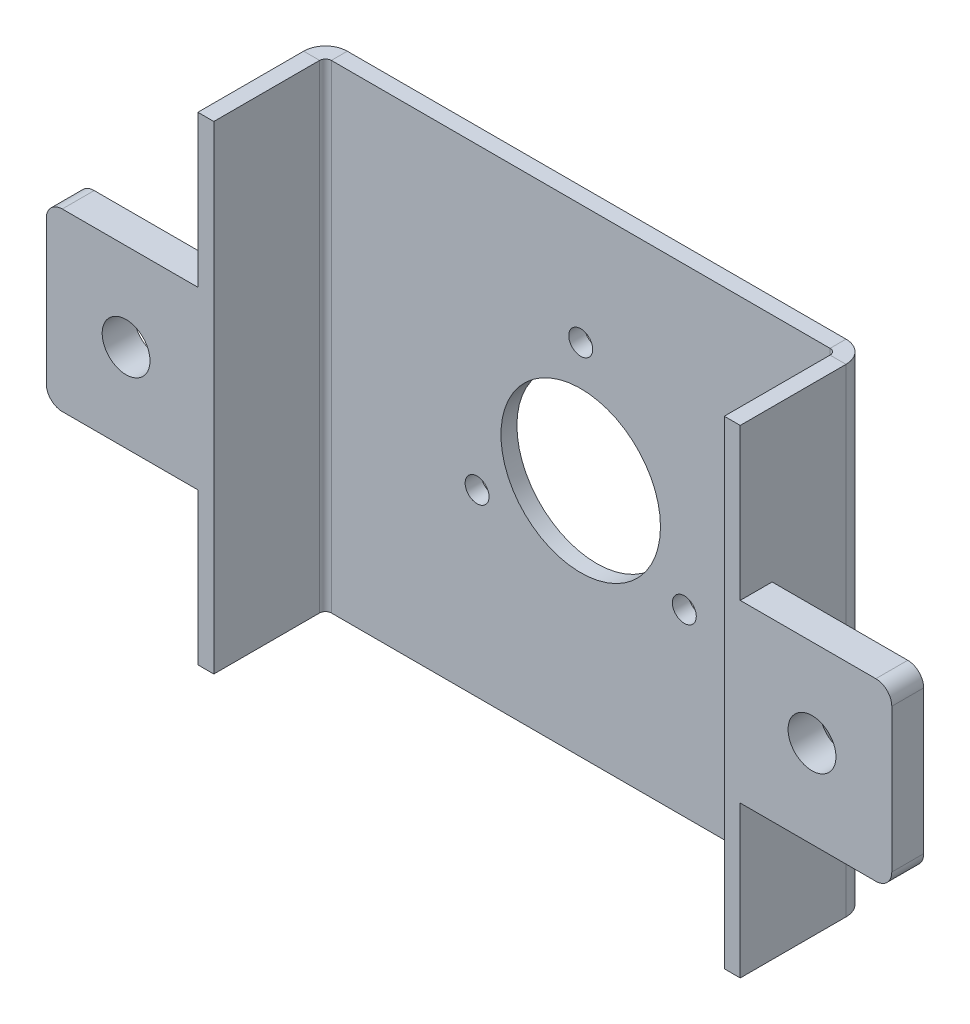
from build123d import *

# Parameters (mm, degrees)
SKETCH1_W                      = 64
SKETCH1_H                      = 60
BASE_FLANGE1_DEPTH             = 2
EDGE_FLANGE1_STRIP_W           = 9.4732
EDGE_FLANGE1_STRIP_H           = 2
EDGE_FLANGE1_STRIP_CUT_DEPTH   = 60
EDGE_FLANGE1_STRIP_2_W         = 9.4732
EDGE_FLANGE1_STRIP_2_H         = 2
EDGE_FLANGE1_STRIP_CUT_2_DEPTH = 60
EDGE_FLANGE1_DEPTH             = 60
EDGE_FLANGE1_BEND_DEPTH        = 60
SKETCH12_W                     = 4
SKETCH12_H                     = 22
BOSS_EXTRUDE1_DEPTH            = 19
FILLET1_R                      = 2
FILLET1_OF_MIRROR1_R           = 2
F_6_0MM_DOWEL_HOLE1_D          = 6
F_6_0MM_DOWEL_HOLE1_DEPTH      = 12
F_6_0MM_DOWEL_HOLE1_TIP        = 1.802581857
CUT_EXTRUDE1_REACH             = 64.49
SKETCH19_R                     = 10
CIRPATTERN1_COUNT              = 3


# Sheet-metal steps are written as plain solids
with BuildPart() as part:
    # Sketch1 → Base-Flange1 (new body)
    with BuildSketch(Plane.XY):
        Rectangle(SKETCH1_W, SKETCH1_H)
    extrude(amount=-BASE_FLANGE1_DEPTH)

    # Edge-Flange1 strip (across the edge) → Edge-Flange1 strip cut (cut)
    with BuildSketch(Plane(origin=(-32, 30, 0), x_dir=(1, 0, 0), z_dir=(0, -1, 0))):
        with Locations((-4, -1)):
            Rectangle(EDGE_FLANGE1_STRIP_W, EDGE_FLANGE1_STRIP_H)
    extrude(amount=EDGE_FLANGE1_STRIP_CUT_DEPTH, mode=Mode.SUBTRACT)

    # Edge-Flange1 strip 2 (across the edge) → Edge-Flange1 strip cut 2 (cut)
    with BuildSketch(Plane(origin=(32, -30, 0), x_dir=(-1, 0, 0), z_dir=(0, 1, 0))):
        with Locations((-4, -1)):
            Rectangle(EDGE_FLANGE1_STRIP_2_W, EDGE_FLANGE1_STRIP_2_H)
    extrude(amount=EDGE_FLANGE1_STRIP_CUT_2_DEPTH, mode=Mode.SUBTRACT)

    # Edge-Flange1 section (across the edge) → Edge-Flange1 (add)
    with BuildSketch(Plane(origin=(-32, 30, 0), x_dir=(1, 0, 0), z_dir=(0, -1, 0))):
        with BuildLine():
            Line((-2, 0.7366), (-2, 14))
            Line((-2, 14), (0, 14))
            Line((0, 14), (0, 0.7366))
            ThreePointArc((0, 0.7366), (0.215745145, 0.215745145), (0.7366, 0))
            Line((0.7366, 0), (0.7366, -2))
            ThreePointArc((0.7366, -2), (-1.198468417, -1.198468417), (-2, 0.7366))
        make_face()
    extrude(amount=EDGE_FLANGE1_DEPTH)

    # Edge-Flange1 section 2 (across the edge) → Edge-Flange1 bend (add)
    with BuildSketch(Plane(origin=(32, -30, 0), x_dir=(-1, 0, 0), z_dir=(0, 1, 0))):
        with BuildLine():
            Line((-2, 0.7366), (-2, 14))
            Line((-2, 14), (0, 14))
            Line((0, 14), (0, 0.7366))
            ThreePointArc((0, 0.7366), (0.215745145, 0.215745145), (0.7366, 0))
            Line((0.7366, 0), (0.7366, -2))
            ThreePointArc((0.7366, -2), (-1.198468417, -1.198468417), (-2, 0.7366))
        make_face()
    extrude(amount=EDGE_FLANGE1_BEND_DEPTH)

    # Sketch12 → Boss-Extrude1 (add)
    with BuildSketch(Plane.ZY.offset(34)):
        with Locations((12, 0)):
            Rectangle(SKETCH12_W, SKETCH12_H)
    boss_extrude1 = extrude(amount=BOSS_EXTRUDE1_DEPTH)

    # Fillet1
    fillet1_edges = [part.edges().sort_by_distance(p)[0] for p in [
        (-53, 11, 12),
        (-53, -11, 12),
    ]]
    fillet(fillet1_edges, radius=FILLET1_R)

    # Mirror1: Boss-Extrude1 across plane
    add(boss_extrude1.mirror(Plane(origin=(0, 0, 0), x_dir=(0, 0, 1), z_dir=(1, 0, 0))))

    # Fillet1 of Mirror1
    fillet1_of_mirror1_edges = [part.edges().sort_by_distance(p)[0] for p in [
        (53, 11, 12),
        (53, -11, 12),
    ]]
    fillet(fillet1_of_mirror1_edges, radius=FILLET1_OF_MIRROR1_R)

    # Ø6.0mm Dowel Hole1
    with Locations(Plane(origin=(0, 0, 10), x_dir=(-1, 0, 0), z_dir=(0, 0, -1))):
        with Locations((-43, 0), (43, 0)):
            Hole(F_6_0MM_DOWEL_HOLE1_D / 2, depth=F_6_0MM_DOWEL_HOLE1_DEPTH)
            with Locations((0, 0, -(F_6_0MM_DOWEL_HOLE1_DEPTH + F_6_0MM_DOWEL_HOLE1_TIP / 2))):  # 118° drill point
                Cone(0, F_6_0MM_DOWEL_HOLE1_D / 2, F_6_0MM_DOWEL_HOLE1_TIP, mode=Mode.SUBTRACT)

    # Sketch19 → Cut-Extrude1 (cut, up to next)
    with BuildSketch(Plane.XY, mode=Mode.PRIVATE) as cut_extrude1_sk1:
        Circle(SKETCH19_R)
    cut_extrude1_tool1 = extrude(cut_extrude1_sk1.sketch, amount=-CUT_EXTRUDE1_REACH, mode=Mode.PRIVATE) & part.part
    add(cut_extrude1_tool1.solids().sort_by_distance((0, 0, 0))[0], mode=Mode.SUBTRACT)

    # Sketch20 → Ø3.0mm Dowel Hole1 (revolve, cut)
    with BuildSketch(Plane(origin=(0, 15, 0), x_dir=(0, -1, 0), z_dir=(1, 0, 0))):
        Polygon((0, 0), (0, 12.901290929), (1.5, 12), (1.5, 0), align=None)
    f_3_0mm_dowel_hole1 = revolve(axis=Axis((0, 15, 6.35), (0, 0, -1)), mode=Mode.SUBTRACT)

    # CirPattern1: Ø3.0mm Dowel Hole1 ×3 about axis
    cirpattern1_axis = Axis((0, 0, 0), (0, 0, 1))
    for i in range(1, CIRPATTERN1_COUNT):
        add(f_3_0mm_dowel_hole1.rotate(cirpattern1_axis, i * 360 / CIRPATTERN1_COUNT), mode=Mode.SUBTRACT)


solid = part.part
